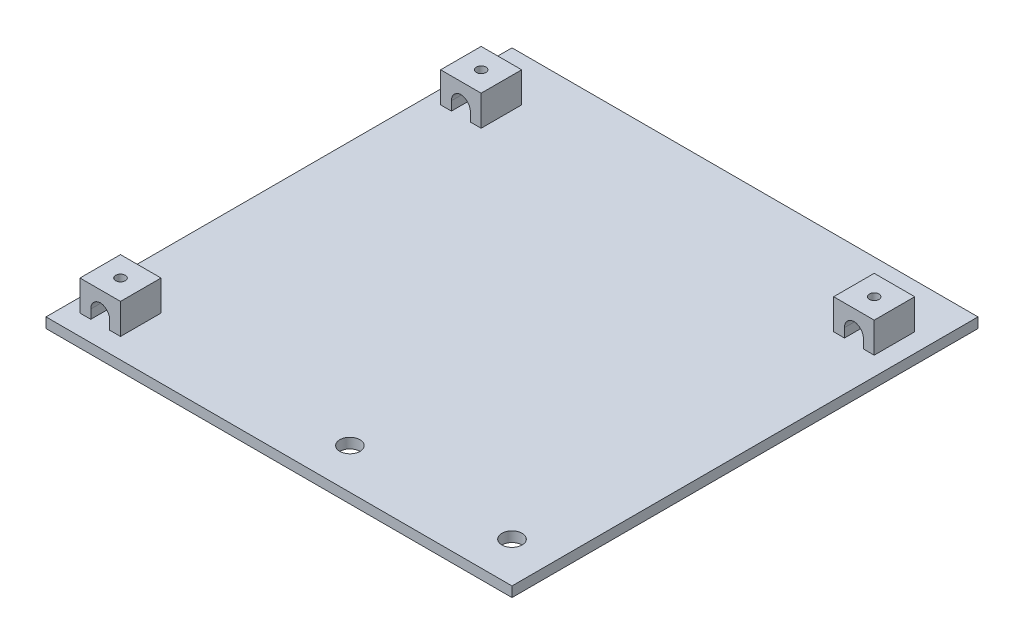
from build123d import *

# Parameters (mm, degrees)
SKETCH1_W           = 146.05
SKETCH1_H           = 146.05
SKETCH1_R           = 3.175
BOSS_EXTRUDE1_DEPTH = 3.175
SKETCH4_W           = 12.7
SKETCH4_H           = 12.7
BOSS_EXTRUDE4_DEPTH = 9.525
SKETCH6_W           = 5.935
SKETCH6_H           = 6
CUT_EXTRUDE2_DEPTH  = 150
SKETCH7_W           = 5.935
SKETCH7_H           = 6
CUT_EXTRUDE3_DEPTH  = 15
SKETCH2_R           = 1.5
CUT_EXTRUDE4_DEPTH  = 15
FILLET2_R           = 3.175


with BuildPart() as part:
    # Sketch1 → Boss-Extrude1 (new body)
    with BuildSketch(Plane(origin=(0, 0, 0), x_dir=(1, 0, 0), z_dir=(0, 1, 0))):
        with Locations((73.025, 73.025)):
            Rectangle(SKETCH1_W, SKETCH1_H)
        with Locations(Location((133.35, 12.7, 0), (0, 0, 270))):
            Circle(SKETCH1_R, mode=Mode.SUBTRACT)
        with Locations(Location((82.55, 12.7, 0), (0, 0, 270))):
            Circle(SKETCH1_R, mode=Mode.SUBTRACT)
    extrude(amount=BOSS_EXTRUDE1_DEPTH)

    # Sketch4 → Boss-Extrude4 (add)
    with BuildSketch(Plane(origin=(0, 3.175, 0), x_dir=(1, 0, 0), z_dir=(0, 1, 0))):
        with Locations((10.648879027, 12.7)):
            Rectangle(SKETCH4_W, SKETCH4_H)
        with Locations((10.648879027, 125.73)):
            Rectangle(SKETCH4_W, SKETCH4_H)
        with Locations((133.838879027, 125.73)):
            Rectangle(SKETCH4_W, SKETCH4_H)
    extrude(amount=BOSS_EXTRUDE4_DEPTH)

    # Sketch6 → Cut-Extrude2 (cut)
    with BuildSketch(Plane.XY.offset(-6.35)):
        with Locations((10.648879027, 6.175)):
            Rectangle(SKETCH6_W, SKETCH6_H)
    extrude(amount=-CUT_EXTRUDE2_DEPTH, mode=Mode.SUBTRACT)

    # Sketch7 → Cut-Extrude3 (cut)
    with BuildSketch(Plane.XY.offset(-119.38)):
        with Locations((133.838879027, 6.175)):
            Rectangle(SKETCH7_W, SKETCH7_H)
    extrude(amount=-CUT_EXTRUDE3_DEPTH, mode=Mode.SUBTRACT)

    # Sketch2 → Cut-Extrude4 (cut)
    with BuildSketch(Plane(origin=(0, 3.175, 0), x_dir=(1, 0, 0), z_dir=(0, 1, 0))):
        with Locations(Location((10.648879027, 125.73, 0), (0, 0, 90))):
            Circle(SKETCH2_R)
        with Locations(Location((133.838879027, 125.73, 0), (0, 0, 180))):
            Circle(SKETCH2_R)
        with Locations(Location((10.648879027, 12.7, 0), (0, 0, 90))):
            Circle(SKETCH2_R)
    extrude(amount=CUT_EXTRUDE4_DEPTH, mode=Mode.SUBTRACT)

    # Fillet2
    # the kernel refuses this fillet: 3.175 mm, written as the material it adds along each edge
    with BuildSketch(Plane(origin=(136.806379027, 9.175, -119.38), x_dir=(0, -1, 0), z_dir=(0, 0, -1))) as fillet2_piece_1_section:
        with BuildLine():
            CenterArc((FILLET2_R, FILLET2_R), FILLET2_R, 180, 90)
            Line((0, FILLET2_R), (0, 0))
            Line((0, 0), (FILLET2_R, 0))
        make_face()
    fillet2_piece_1 = extrude(amount=12.7, mode=Mode.PRIVATE)
    fillet2_piece_1 = fillet2_piece_1 - Plane(origin=(133.838879027, 8.440537645, -125.73), x_dir=(-1, 0, 0), z_dir=(0, -1, 0)) * Cylinder(1.5, 39, mode=Mode.PRIVATE)
    add(fillet2_piece_1)
    with BuildSketch(Plane(origin=(130.871379027, 9.175, -119.38), x_dir=(0, -1, 0), z_dir=(0, 0, -1))) as fillet2_piece_2_section:
        with BuildLine():
            CenterArc((FILLET2_R, -FILLET2_R), FILLET2_R, 90, 90)
            Line((0, -FILLET2_R), (0, 0))
            Line((0, 0), (FILLET2_R, 0))
        make_face()
    fillet2_piece_2 = extrude(amount=12.7, mode=Mode.PRIVATE)
    fillet2_piece_2 = fillet2_piece_2 - Plane(origin=(133.838879027, 8.44053751, -125.73), x_dir=(-1, 0, 0), z_dir=(0, -1, 0)) * Cylinder(1.5, 39, mode=Mode.PRIVATE)
    add(fillet2_piece_2)
    with BuildSketch(Plane(origin=(13.616379027, 9.175, -119.38), x_dir=(0, -1, 0), z_dir=(0, 0, -1))) as fillet2_piece_3_section:
        with BuildLine():
            CenterArc((FILLET2_R, FILLET2_R), FILLET2_R, 180, 90)
            Line((0, FILLET2_R), (0, 0))
            Line((0, 0), (FILLET2_R, 0))
        make_face()
    fillet2_piece_3 = extrude(amount=12.7, mode=Mode.PRIVATE)
    fillet2_piece_3 = fillet2_piece_3 - Plane(origin=(10.648879027, 8.440537543, -125.73), x_dir=(0, 0, -1), z_dir=(0, -1, 0)) * Cylinder(1.5, 39, mode=Mode.PRIVATE)
    add(fillet2_piece_3)
    with BuildSketch(Plane(origin=(7.681379027, 9.175, -119.38), x_dir=(0, -1, 0), z_dir=(0, 0, -1))) as fillet2_piece_4_section:
        with BuildLine():
            CenterArc((FILLET2_R, -FILLET2_R), FILLET2_R, 90, 90)
            Line((0, -FILLET2_R), (0, 0))
            Line((0, 0), (FILLET2_R, 0))
        make_face()
    fillet2_piece_4 = extrude(amount=12.7, mode=Mode.PRIVATE)
    fillet2_piece_4 = fillet2_piece_4 - Plane(origin=(10.648879027, 8.440537622, -125.73), x_dir=(0, 0, -1), z_dir=(0, -1, 0)) * Cylinder(1.5, 39, mode=Mode.PRIVATE)
    add(fillet2_piece_4)
    with BuildSketch(Plane(origin=(13.616379027, 9.175, -6.35), x_dir=(0, -1, 0), z_dir=(0, 0, -1))) as fillet2_piece_5_section:
        with BuildLine():
            CenterArc((FILLET2_R, FILLET2_R), FILLET2_R, 180, 90)
            Line((0, FILLET2_R), (0, 0))
            Line((0, 0), (FILLET2_R, 0))
        make_face()
    fillet2_piece_5 = extrude(amount=12.7, mode=Mode.PRIVATE)
    fillet2_piece_5 = fillet2_piece_5 - Plane(origin=(10.648879027, 8.440537543, -12.7), x_dir=(0, 0, -1), z_dir=(0, -1, 0)) * Cylinder(1.5, 39, mode=Mode.PRIVATE)
    add(fillet2_piece_5)
    with BuildSketch(Plane(origin=(7.681379027, 9.175, -6.35), x_dir=(0, -1, 0), z_dir=(0, 0, -1))) as fillet2_piece_6_section:
        with BuildLine():
            CenterArc((FILLET2_R, -FILLET2_R), FILLET2_R, 90, 90)
            Line((0, -FILLET2_R), (0, 0))
            Line((0, 0), (FILLET2_R, 0))
        make_face()
    fillet2_piece_6 = extrude(amount=12.7, mode=Mode.PRIVATE)
    fillet2_piece_6 = fillet2_piece_6 - Plane(origin=(10.648879027, 8.440537622, -12.7), x_dir=(0, 0, -1), z_dir=(0, -1, 0)) * Cylinder(1.5, 39, mode=Mode.PRIVATE)
    add(fillet2_piece_6)


solid = part.part
